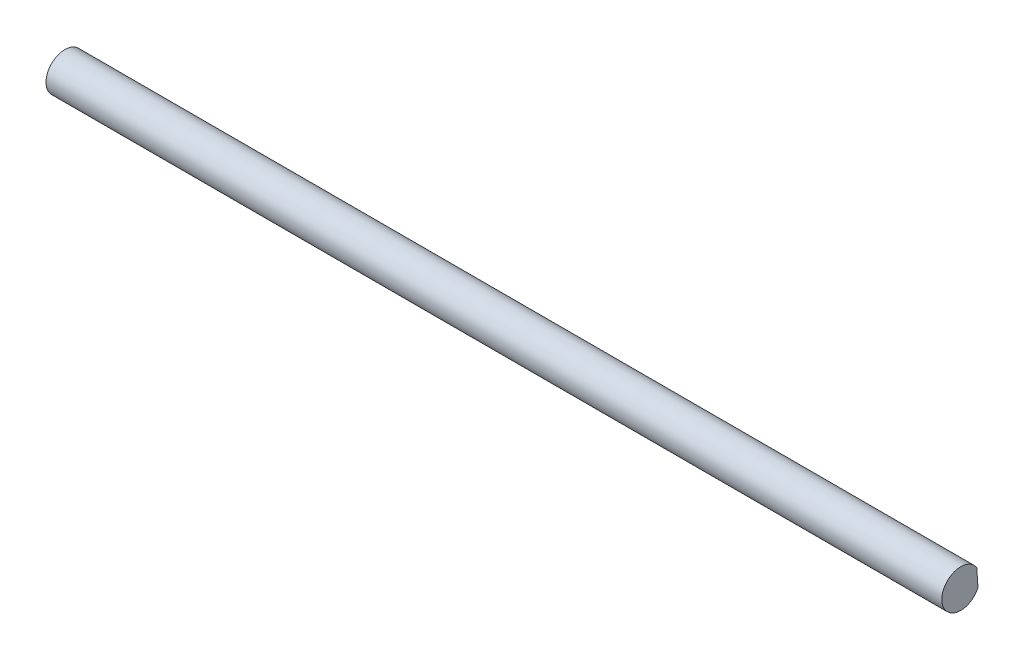
from build123d import *

# Parameters (mm, degrees)
BOSS_EXTRU_1_DEPTH = 150


with BuildPart() as part:
    # Esquisse1 → Boss.-Extru.1 (new body)
    with BuildSketch(Plane(origin=(0, 0, 0), x_dir=(0, 0, -1), z_dir=(1, 0, 0))):
        with BuildLine():
            Line((2.891496859, -1.31143849), (2.683155312, 1.697440006))
            ThreePointArc((2.683155312, 1.697440006), (-3.167416006, -0.219319043), (2.891496859, -1.31143849))
        make_face()
    extrude(amount=BOSS_EXTRU_1_DEPTH)


solid = part.part
